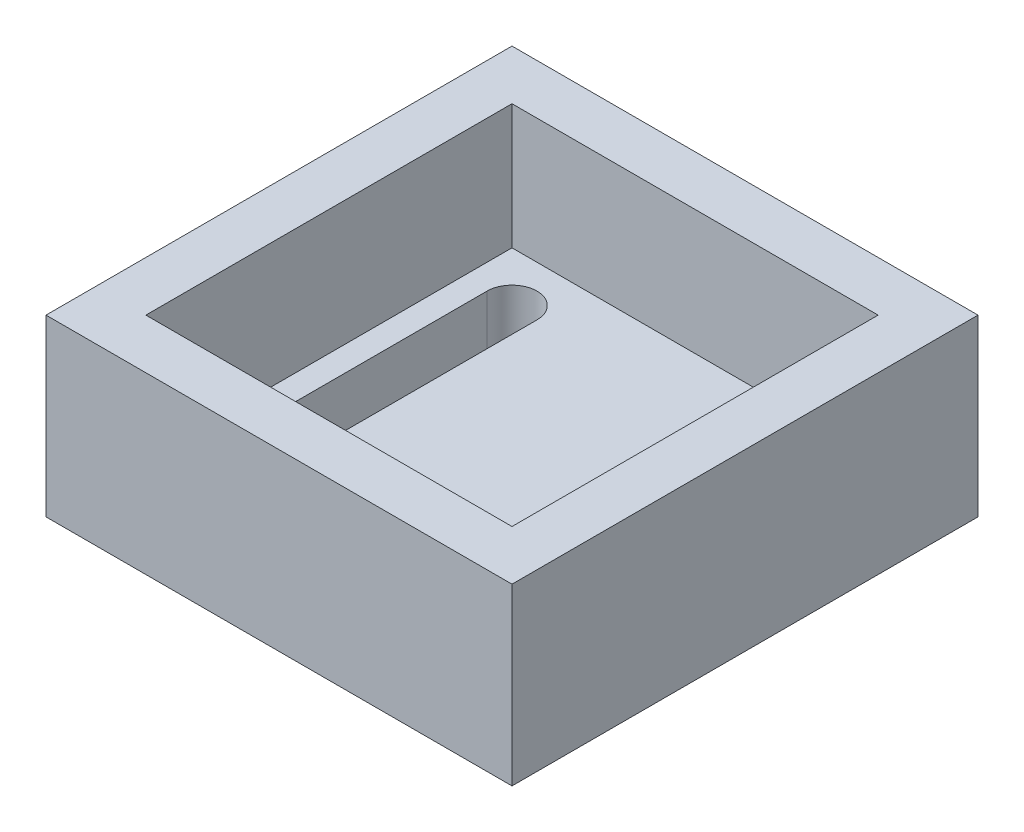
from build123d import *

# Parameters (mm, degrees)
SKETCH2_W           = 28
SKETCH2_H           = 28
BOSS_EXTRUDE1_DEPTH = 10.5
SKETCH3_R           = 1.5
CUT_EXTRUDE1_DEPTH  = 41.966449688
SKETCH5_W           = 22
SKETCH5_H           = 22
CUT_EXTRUDE2_DEPTH  = 7.5


with BuildPart() as part:
    # Sketch2 → Boss-Extrude1 (new body)
    with BuildSketch(Plane(origin=(0, 0, 0), x_dir=(1, 0, 0), z_dir=(0, 1, 0))):
        with Locations((14, 14)):
            Rectangle(SKETCH2_W, SKETCH2_H)
    extrude(amount=BOSS_EXTRUDE1_DEPTH)

    # Sketch3 → Cut-Extrude1 (cut, through all)
    with BuildSketch(Plane(origin=(0, 0, 0), x_dir=(1, 0, 0), z_dir=(0, 1, 0))):
        with Locations((22, 22)):
            Circle(SKETCH3_R)
        with Locations((22, 6)):
            Circle(SKETCH3_R)
        with BuildLine():
            Line((7.5, 22), (7.5, 6))
            ThreePointArc((7.5, 6), (6, 4.5), (4.5, 6))
            Line((4.5, 6), (4.5, 22))
            ThreePointArc((4.5, 22), (6, 23.5), (7.5, 22))
        make_face()
    extrude(amount=CUT_EXTRUDE1_DEPTH, mode=Mode.SUBTRACT)

    # Sketch5 → Cut-Extrude2 (cut)
    with BuildSketch(Plane(origin=(0, 10.5, 0), x_dir=(1, 0, 0), z_dir=(0, 1, 0))):
        with Locations((14, 14)):
            Rectangle(SKETCH5_W, SKETCH5_H)
    extrude(amount=-CUT_EXTRUDE2_DEPTH, mode=Mode.SUBTRACT)


solid = part.part
